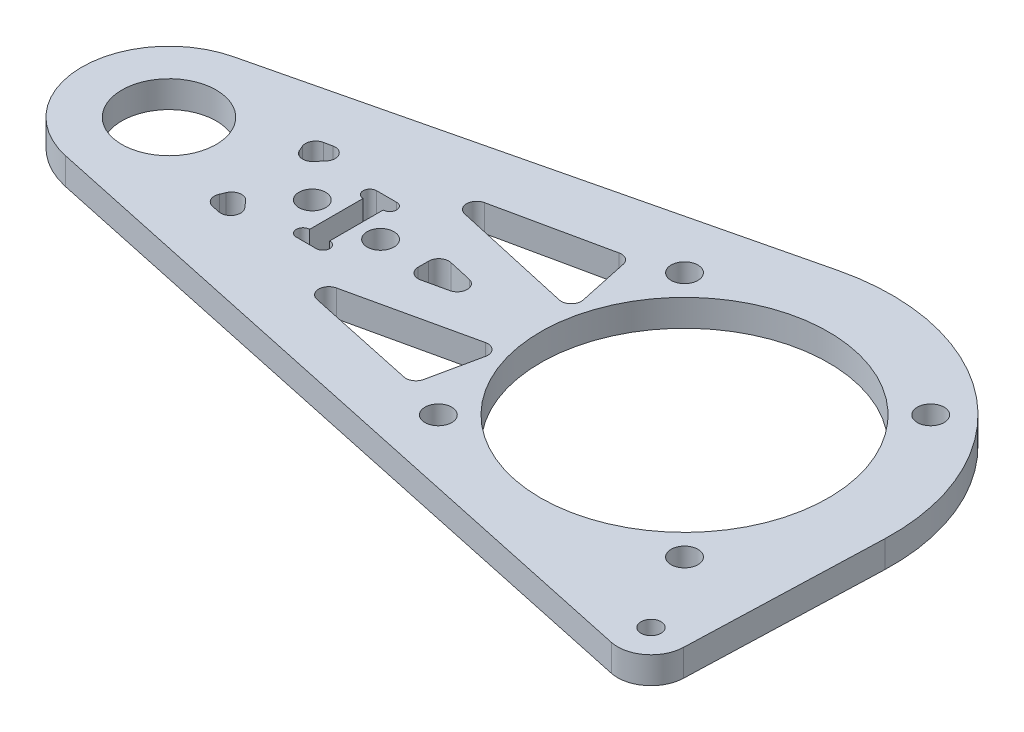
from build123d import *

# Parameters (mm, degrees)
OTHER_194_OUTLINE_R   = 1.5
OTHER_194_OUTLINE_R_2 = 2
OTHER_194_OUTLINE_R_3 = 7.05
OTHER_194_OUTLINE_R_4 = 13
OTHER_194_DEPTH       = 4
SKETCH_2_R            = 21.5
CUT_EXTRUDE_1_DEPTH   = 97.648848933


# Read off the part's stored shape, not the designer's step: 摆臂_镜向
with BuildPart() as part:
    # Other 194 outline → Other 194 (new body)
    with BuildSketch(Plane(origin=(0, 0, 0), x_dir=(1, 0, 0), z_dir=(0, 1, 0))):
        with BuildLine():
            ThreePointArc((-80.038961039, 12.639806795), (-89.998966964, -0.163883698), (-79.719334557, -12.712404162))
            Line((-79.719334557, -12.712404162), (23.954102093, -34.889386216))
            ThreePointArc((23.954102093, -34.889386216), (28.077901504, -33.940370837), (29.997141433, -30.169048806))
            Line((29.997141433, -30.169048806), (30.982276884, -1.048102596))
            ThreePointArc((30.982276884, -1.048102596), (19.596811299, 24.020095481), (-7.246753247, 30.141077741))
            Line((-7.246753247, 30.141077741), (-80.038961039, 12.639806795))
        make_face()
        with BuildLine():
            ThreePointArc((-62.228072273, -8.273007388), (-63.252931738, -7.483002306), (-63.281586626, -6.189316158))
            ThreePointArc((-63.281586626, -6.189316158), (-63.134274256, -5.851850099), (-62.995261901, -5.510881125))
            ThreePointArc((-62.995261901, -5.510881125), (-61.849651838, -4.581154117), (-60.461969326, -5.082304763))
            Line((-60.461969326, -5.082304763), (-59.605161669, -6.078992007))
            ThreePointArc((-59.605161669, -6.078992007), (-59.452788579, -7.822528522), (-61.056402543, -8.523641489))
            Line((-61.056402543, -8.523641489), (-62.228072273, -8.273007388))
        make_face(mode=Mode.SUBTRACT)
        with BuildLine():
            Line((-25.836688979, -16.057557417), (-42.41065304, -12.512189235))
            ThreePointArc((-42.41065304, -12.512189235), (-43.596867532, -11.052331075), (-42.424246953, -9.581531412))
            Line((-42.424246953, -9.581531412), (-24.221088321, -5.510705486))
            ThreePointArc((-24.221088321, -5.510705486), (-22.837996114, -5.908978844), (-22.426909172, -7.288316817))
            Line((-22.426909172, -7.288316817), (-24.056103742, -14.904510924))
            ThreePointArc((-24.056103742, -14.904510924), (-24.707592613, -15.849805447), (-25.836688979, -16.057557417))
        make_face(mode=Mode.SUBTRACT)
        with Locations((25, -30)):
            Circle(OTHER_194_OUTLINE_R, mode=Mode.SUBTRACT)
        with Locations((-18.384776311, -18.384776311)):
            Circle(OTHER_194_OUTLINE_R_2, mode=Mode.SUBTRACT)
        with Locations((-12.374368671, -12.374368671)):
            Circle(OTHER_194_OUTLINE_R_2, mode=Mode.SUBTRACT)
        with Locations((12.374368671, -12.374368671)):
            Circle(OTHER_194_OUTLINE_R_2, mode=Mode.SUBTRACT)
        with Locations((18.384776311, -18.384776311)):
            Circle(OTHER_194_OUTLINE_R_2, mode=Mode.SUBTRACT)
        with Locations((-77, 0)):
            Circle(OTHER_194_OUTLINE_R_3, mode=Mode.SUBTRACT)
        with BuildLine():
            ThreePointArc((-60.461969326, 5.082304763), (-61.849651838, 4.581154117), (-62.995261901, 5.510881125))
            ThreePointArc((-62.995261901, 5.510881125), (-63.134274256, 5.851850099), (-63.281586626, 6.189316158))
            ThreePointArc((-63.281586626, 6.189316158), (-63.252931738, 7.483002306), (-62.228072273, 8.273007388))
            Line((-62.228072273, 8.273007388), (-61.056402543, 8.523641489))
            ThreePointArc((-61.056402543, 8.523641489), (-59.452788579, 7.822528522), (-59.605161669, 6.078992007))
            Line((-59.605161669, 6.078992007), (-60.461969326, 5.082304763))
        make_face(mode=Mode.SUBTRACT)
        with Locations((-55.6, 0)):
            Circle(OTHER_194_OUTLINE_R_2, mode=Mode.SUBTRACT)
        with BuildLine():
            Line((-49, 4), (-49, -4))
            ThreePointArc((-49, -4), (-48, -5), (-49, -6))
            Line((-49, -6), (-52, -6))
            ThreePointArc((-52, -6), (-53, -5), (-52, -4))
            Line((-52, -4), (-52, 4))
            ThreePointArc((-52, 4), (-53, 5), (-52, 6))
            Line((-52, 6), (-49, 6))
            ThreePointArc((-49, 6), (-48, 5), (-49, 4))
        make_face(mode=Mode.SUBTRACT)
        with Locations((-45.4, 0)):
            Circle(OTHER_194_OUTLINE_R_2, mode=Mode.SUBTRACT)
        with BuildLine():
            Line((-39, -0.79505171), (-39, 0.79505171))
            ThreePointArc((-39, 0.79505171), (-38.437804637, 1.965744865), (-37.172636716, 2.258893669))
            Line((-37.172636716, 2.258893669), (-33.617473054, 1.463841959))
            ThreePointArc((-33.617473054, 1.463841959), (-32.444836338, 0), (-33.617473054, -1.463841959))
            Line((-33.617473054, -1.463841959), (-37.172636716, -2.258893669))
            ThreePointArc((-37.172636716, -2.258893669), (-38.437804637, -1.965744865), (-39, -0.79505171))
        make_face(mode=Mode.SUBTRACT)
        with BuildLine():
            Line((-24.221088321, 5.510705486), (-42.424246953, 9.581531412))
            ThreePointArc((-42.424246953, 9.581531412), (-43.596867532, 11.052331075), (-42.41065304, 12.512189235))
            Line((-42.41065304, 12.512189235), (-25.836688979, 16.057557417))
            ThreePointArc((-25.836688979, 16.057557417), (-24.707592613, 15.849805447), (-24.056103742, 14.904510924))
            Line((-24.056103742, 14.904510924), (-22.426909172, 7.288316817))
            ThreePointArc((-22.426909172, 7.288316817), (-22.837996114, 5.908978844), (-24.221088321, 5.510705486))
        make_face(mode=Mode.SUBTRACT)
        Circle(OTHER_194_OUTLINE_R_4, mode=Mode.SUBTRACT)
        with Locations((-12.374368671, 12.374368671)):
            Circle(OTHER_194_OUTLINE_R_2, mode=Mode.SUBTRACT)
        with Locations((12.374368671, 12.374368671)):
            Circle(OTHER_194_OUTLINE_R_2, mode=Mode.SUBTRACT)
        with Locations((-18.384776311, 18.384776311)):
            Circle(OTHER_194_OUTLINE_R_2, mode=Mode.SUBTRACT)
        with Locations((18.384776311, 18.384776311)):
            Circle(OTHER_194_OUTLINE_R_2, mode=Mode.SUBTRACT)
    extrude(amount=OTHER_194_DEPTH)

    # 草图2 → 切除-拉伸1 (cut, through all)
    with BuildSketch(Plane(origin=(0, 4, 0), x_dir=(1, 0, 0), z_dir=(0, 1, 0))):
        with Locations(Location((0, 0, 0), (0, 0, 270))):
            Circle(SKETCH_2_R)
    extrude(amount=-CUT_EXTRUDE_1_DEPTH, mode=Mode.SUBTRACT)


solid = part.part
